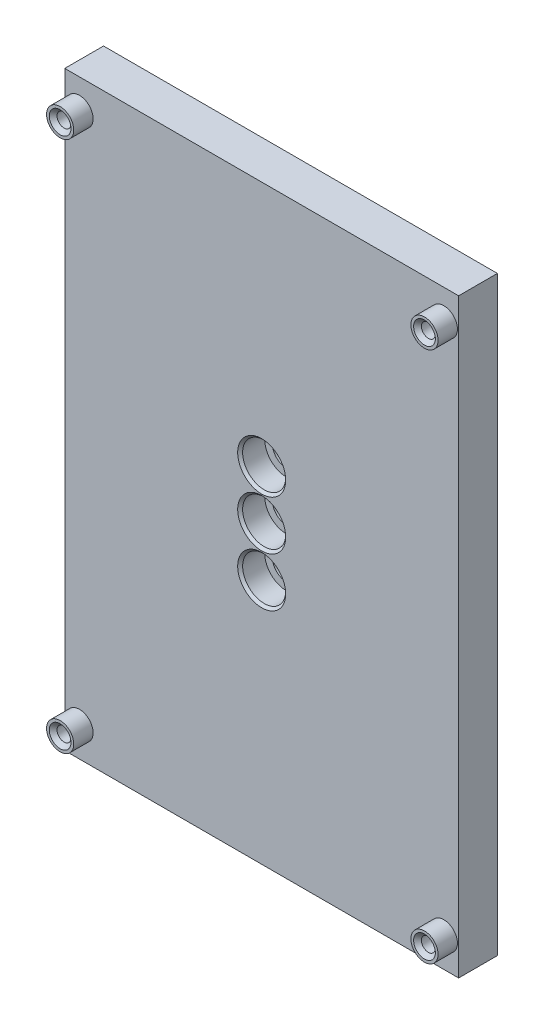
from build123d import *

# Parameters (mm, degrees)
SKETCH1_W                                     = 101.6
SKETCH1_H                                     = 152.4
BOSS_EXTRUDE1_DEPTH                           = 10
CBORE_FOR_1_4_SOCKET_HEAD_CAP_SCREW1_AT_COUNT = 2
CBORE_FOR_1_4_SOCKET_HEAD_CAP_SCREW1_AT_PITCH = 25.4
CBORE_FOR_1_4_SOCKET_HEAD_CAP_SCREW1_2_COUNT  = 2
CBORE_FOR_1_4_SOCKET_HEAD_CAP_SCREW1_2_PITCH  = 12.7
SKETCH5_R                                     = 3.5
BOSS_EXTRUDE2_DEPTH                           = 5
SKETCH6_R                                     = 1.8
CUT_EXTRUDE1_DEPTH                            = 93.801293094
CHAMFER1_SIZE                                 = 1


with BuildPart() as part:
    # Sketch1 → Boss-Extrude1 (new body)
    with BuildSketch(Plane.XY):
        Rectangle(SKETCH1_W, SKETCH1_H)
    extrude(amount=BOSS_EXTRUDE1_DEPTH)

    # Sketch4 → CBORE for 1/4 Socket Head Cap Screw1 (revolve, cut)
    with BuildSketch(Plane(origin=(0, 12.7, 10), x_dir=(0, -1, 0), z_dir=(1, 0, 0))):
        Polygon((0, 0), (0, 10), (3.57124, 10), (3.57124, 6.35), (5.55625, 6.35), (5.55625, 0.635), (6.19125, 0), align=None)
    cbore_for_1_4_socket_head_cap_screw1 = revolve(axis=Axis((0, 12.7, 16.35), (0, 0, -1)), mode=Mode.SUBTRACT)

    # CBORE for 1/4 Socket Head Cap Screw1 at: CBORE for 1/4 Socket Head Cap Screw1 ×2
    with Locations(*[(0, -i * CBORE_FOR_1_4_SOCKET_HEAD_CAP_SCREW1_AT_PITCH, 0) for i in range(1, CBORE_FOR_1_4_SOCKET_HEAD_CAP_SCREW1_AT_COUNT)]):
        add(cbore_for_1_4_socket_head_cap_screw1, mode=Mode.SUBTRACT)

    # CBORE for 1_4 Socket Head Cap Screw1 2: CBORE for 1/4 Socket Head Cap Screw1 ×2
    with Locations(*[(0, -i * CBORE_FOR_1_4_SOCKET_HEAD_CAP_SCREW1_2_PITCH, 0) for i in range(1, CBORE_FOR_1_4_SOCKET_HEAD_CAP_SCREW1_2_COUNT)]):
        add(cbore_for_1_4_socket_head_cap_screw1, mode=Mode.SUBTRACT)

    # Sketch5 → Boss-Extrude2 (add)
    with BuildSketch(Plane.XY.offset(10)):
        with Locations((-46.99, -68.58)):
            Circle(SKETCH5_R)
        with Locations((46.99, -68.58)):
            Circle(SKETCH5_R)
        with Locations((-46.99, 68.58)):
            Circle(SKETCH5_R)
        with Locations((46.99, 68.58)):
            Circle(SKETCH5_R)
    extrude(amount=BOSS_EXTRUDE2_DEPTH)

    # Sketch6 → Cut-Extrude1 (cut, through all)
    with BuildSketch(Plane.XY.offset(15)):
        with Locations((46.99, 68.58)):
            Circle(SKETCH6_R)
        with Locations((-46.99, 68.58)):
            Circle(SKETCH6_R)
        with Locations((-46.99, -68.58)):
            Circle(SKETCH6_R)
        with Locations((46.99, -68.58)):
            Circle(SKETCH6_R)
    extrude(amount=-CUT_EXTRUDE1_DEPTH, mode=Mode.SUBTRACT)

    # Chamfer1
    chamfer1_edges = [part.edges().sort_by_distance(p)[0] for p in [
        (-48.79, -68.58, 15),
        (45.19, -68.58, 15),
        (-48.79, 68.58, 15),
        (45.19, 68.58, 15),
    ]]
    chamfer(chamfer1_edges, length=CHAMFER1_SIZE)


solid = part.part
